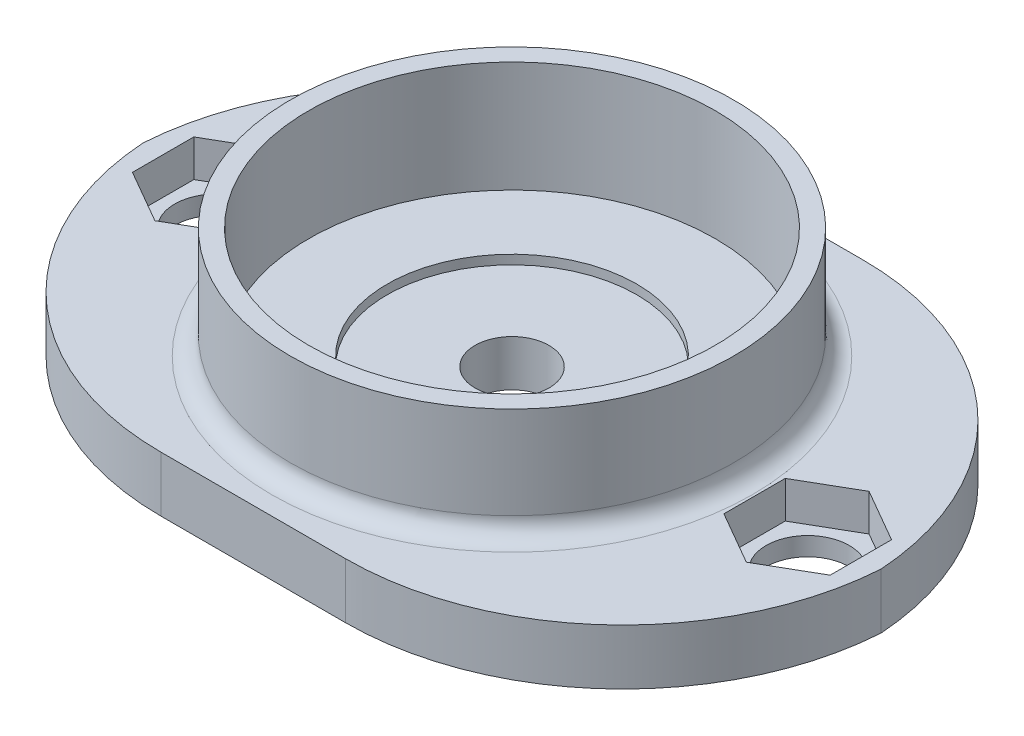
from build123d import *

# Parameters (mm, degrees)
SKETCH2_W           = 40
SKETCH2_H           = 28
BOSS_EXTRUDE1_DEPTH = 3
SKETCH3_R           = 12
SKETCH3_R_2         = 11
BOSS_EXTRUDE2_DEPTH = 6
CUT_EXTRUDE1_DEPTH  = 2
FILLET1_R           = 1
FILLET2_R           = 15
SKETCH8_R           = 6.75
CUT_EXTRUDE2_DEPTH  = 0.5
SKETCH9_R           = 2
CUT_EXTRUDE3_DEPTH  = 26.237200627


with BuildPart() as part:
    # Sketch2 → Boss-Extrude1 (new body)
    with BuildSketch(Plane(origin=(0, 0, 0), x_dir=(1, 0, 0), z_dir=(0, 1, 0))):
        Rectangle(SKETCH2_W, SKETCH2_H)
    extrude(amount=BOSS_EXTRUDE1_DEPTH)

    # Sketch3 → Boss-Extrude2 (add)
    with BuildSketch(Plane(origin=(0, 3, 0), x_dir=(1, 0, 0), z_dir=(0, 1, 0))):
        with Locations(Location((0, 0, 0), (0, 0, 270))):
            Circle(SKETCH3_R)
        with Locations(Location((0, 0, 0), (0, 0, 270))):
            Circle(SKETCH3_R_2, mode=Mode.SUBTRACT)
    extrude(amount=BOSS_EXTRUDE2_DEPTH)

    # Sketch4 → Cut-Extrude1 (cut)
    with BuildSketch(Plane(origin=(0, 3, 0), x_dir=(1, 0, 0), z_dir=(0, 1, 0))):
        Polygon((-16, 3.319764048), (-18.875, 1.659882024), (-18.875, -1.659882024), (-16, -3.319764048), (-13.125, -1.659882024), (-13.125, 1.659882024), align=None)
    cut_extrude1 = extrude(amount=-CUT_EXTRUDE1_DEPTH, mode=Mode.SUBTRACT)

    # Sketch6 → M4 Clearance Hole1 (revolve, cut)
    with BuildSketch(Plane(origin=(-16, 1, 0), x_dir=(0, 0, 1), z_dir=(1, 0, 0))):
        Polygon((0, 0), (0, 3.351936393), (2.25, 2), (2.25, 0), align=None)
    m4_clearance_hole1 = revolve(axis=Axis((-16, 7.35, 0), (0, -1, 0)), mode=Mode.SUBTRACT)

    # Mirror1: Cut-Extrude1, M4 Clearance Hole1 across plane
    add(cut_extrude1.mirror(Plane(origin=(0, 0, 0), x_dir=(0, 0, 1), z_dir=(1, 0, 0))), mode=Mode.SUBTRACT)
    add(m4_clearance_hole1.mirror(Plane(origin=(0, 0, 0), x_dir=(0, 0, 1), z_dir=(1, 0, 0))), mode=Mode.SUBTRACT)

    # Fillet1
    fillet1_edges = [part.edges().sort_by_distance(p)[0] for p in [
        (0, 3, -12),
    ]]
    fillet(fillet1_edges, radius=FILLET1_R)

    # Fillet2
    # the kernel refuses this fillet: 15 mm, written as the material it takes off along each edge
    with BuildSketch(Plane(origin=(-20, -37.5, -14), x_dir=(1, 0, 0), z_dir=(0, 1, 0)), Plane(origin=(-20, -37.5, 14), x_dir=(0, 0, -1), z_dir=(0, 1, 0))) as fillet2_piece_1:
        with BuildLine():
            CenterArc((FILLET2_R, -FILLET2_R), FILLET2_R, 90, 90)
            Line((0, -FILLET2_R), (0, 0))
            Line((0, 0), (FILLET2_R, 0))
        make_face()
    extrude(amount=78, mode=Mode.SUBTRACT)
    with BuildSketch(Plane(origin=(20, -37.5, 14), x_dir=(0, 0, -1), z_dir=(0, 1, 0)), Plane(origin=(20, -37.5, -14), x_dir=(-1, 0, 0), z_dir=(0, 1, 0))) as fillet2_piece_2:
        with BuildLine():
            CenterArc((FILLET2_R, FILLET2_R), FILLET2_R, 180, 90)
            Line((0, FILLET2_R), (0, 0))
            Line((0, 0), (FILLET2_R, 0))
        make_face()
    extrude(amount=78, mode=Mode.SUBTRACT)

    # Sketch8 → Cut-Extrude2 (cut)
    with BuildSketch(Plane(origin=(0, 3, 0), x_dir=(1, 0, 0), z_dir=(0, 1, 0))):
        with Locations(Location((0, 0, 0), (0, 0, 270))):
            Circle(SKETCH8_R)
    extrude(amount=-CUT_EXTRUDE2_DEPTH, mode=Mode.SUBTRACT)

    # Sketch9 → Cut-Extrude3 (cut, through all)
    with BuildSketch(Plane(origin=(0, 2.5, 0), x_dir=(1, 0, 0), z_dir=(0, 1, 0))):
        with Locations(Location((0, 0, 0), (0, 0, 270))):
            Circle(SKETCH9_R)
    extrude(amount=-CUT_EXTRUDE3_DEPTH, mode=Mode.SUBTRACT)


solid = part.part
